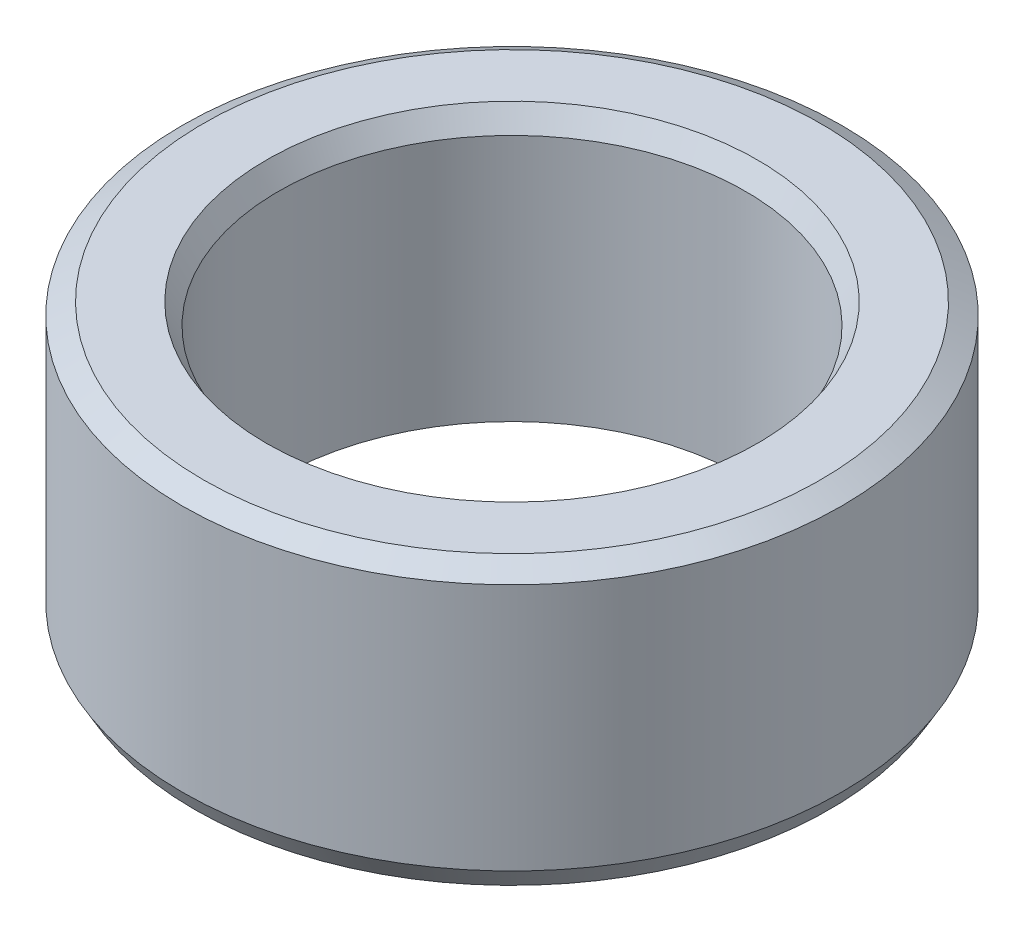
from build123d import *
from OCP.BRepFilletAPI import BRepFilletAPI_MakeChamfer

# Parameters (mm, degrees)
SKETCH1_R           = 30
BOSS_EXTRUDE1_DEPTH = 25.570923493
SKETCH2_R           = 21.236265687
CUT_EXTRUDE1_DEPTH  = 50.536573643
CHAMFER1_SIZE       = 1.105534199
CHAMFER1_SIZE2      = 1.914841402


with BuildPart() as part:
    # Sketch1 → Boss-Extrude1 (new body)
    with BuildSketch(Plane(origin=(0, 0, 0), x_dir=(1, 0, 0), z_dir=(0, 1, 0))):
        Circle(SKETCH1_R)
    extrude(amount=BOSS_EXTRUDE1_DEPTH)

    # Sketch2 → Cut-Extrude1 (cut, through all)
    with BuildSketch(Plane(origin=(0, 0, 0), x_dir=(1, 0, 0), z_dir=(0, 1, 0))):
        Circle(SKETCH2_R)
    extrude(amount=CUT_EXTRUDE1_DEPTH, mode=Mode.SUBTRACT)

    # Chamfer1: one chamfer whose edges measure the first distance from different faces: ONE call of the kernel's chamfer builder (chamfer() names one face for all edges)
    chamfer1_edges_1 = [part.edges().sort_by_distance(p)[0] for p in [
        (-21.236265687, 25.570923493, 0),
    ]]
    chamfer1_side_1 = [part.faces().sort_by_distance(p)[0] for p in [
        (-29.151471863, 25.570923493, 0),
    ]]
    chamfer1_edges_2 = [part.edges().sort_by_distance(p)[0] for p in [
        (-21.236265687, 0, 0),
    ]]
    chamfer1_side_2 = [part.faces().sort_by_distance(p)[0] for p in [
        (-21.236265687, 12.785461747, 0),
    ]]
    chamfer1_edges_3 = [part.edges().sort_by_distance(p)[0] for p in [
        (-30, 0, 0),
    ]]
    chamfer1_side_3 = [part.faces().sort_by_distance(p)[0] for p in [
        (-29.151471863, 0, 0),
    ]]
    chamfer1_edges_4 = [part.edges().sort_by_distance(p)[0] for p in [
        (-30, 25.570923493, 0),
    ]]
    chamfer1_side_4 = [part.faces().sort_by_distance(p)[0] for p in [
        (-30, 12.785461747, 0),
    ]]
    chamfer1 = BRepFilletAPI_MakeChamfer(part.part.solid().wrapped)
    for e in chamfer1_edges_1:
        chamfer1.Add(CHAMFER1_SIZE, CHAMFER1_SIZE2, e.wrapped, chamfer1_side_1[0].wrapped)  # the first distance lies on this face
    for e in chamfer1_edges_2:
        chamfer1.Add(CHAMFER1_SIZE, CHAMFER1_SIZE2, e.wrapped, chamfer1_side_2[0].wrapped)  # the first distance lies on this face
    for e in chamfer1_edges_3:
        chamfer1.Add(CHAMFER1_SIZE, CHAMFER1_SIZE2, e.wrapped, chamfer1_side_3[0].wrapped)  # the first distance lies on this face
    for e in chamfer1_edges_4:
        chamfer1.Add(CHAMFER1_SIZE, CHAMFER1_SIZE2, e.wrapped, chamfer1_side_4[0].wrapped)  # the first distance lies on this face
    add(Compound.cast(chamfer1.Shape()), mode=Mode.REPLACE)


solid = part.part
